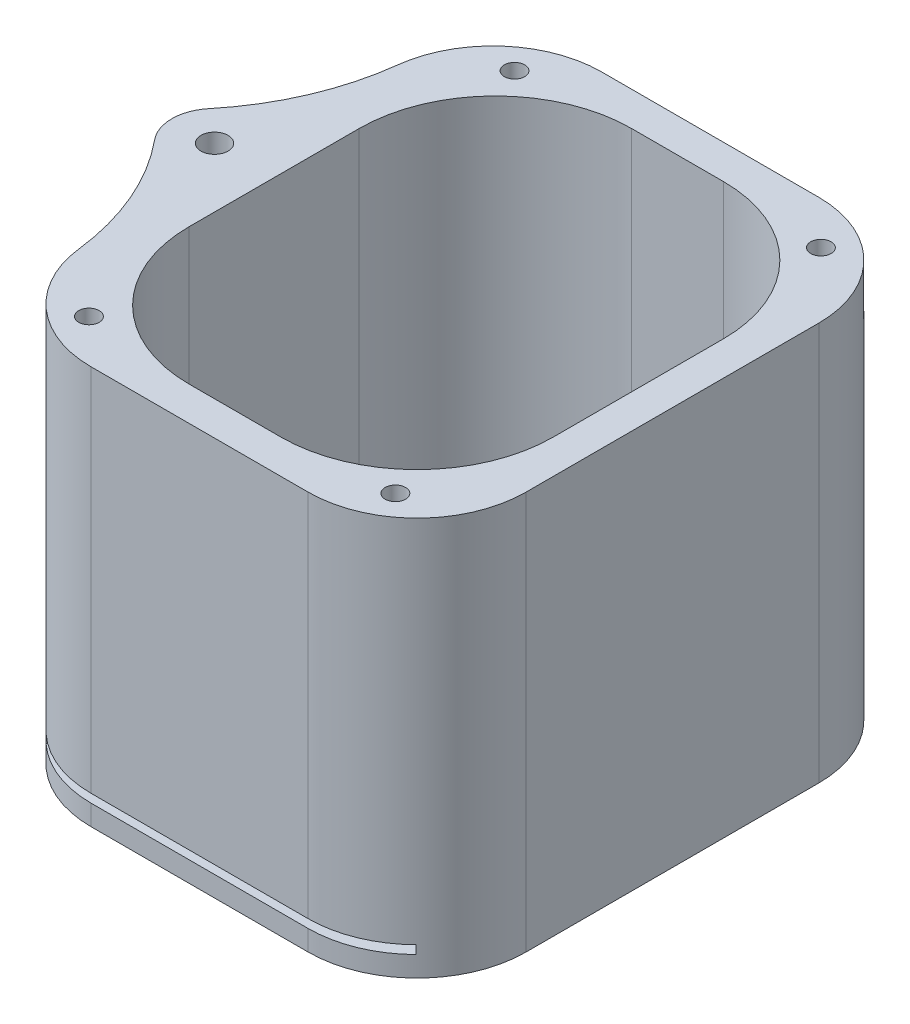
from build123d import *

# Parameters (mm, degrees)
CUT_EXTRUDE1_REACH       = 130.224
SKETCH3_W                = 13.598117377
SKETCH3_H                = 26.0138757
BOSS_EXTRUDE1_DEPTH      = 75
BOSS_EXTRUDE1_DEPTH_BACK = 75
SKETCH2_W                = 127
SKETCH2_H                = 117
BOSS_EXTRUDE3_START      = -117
BOSS_EXTRUDE3_DEPTH      = 117
CUT_EXTRUDE2_DEPTH       = 200.610245228
CUT_EXTRUDE2_DEPTH_BACK  = 200.610245228
SKETCH5_W                = 107
SKETCH5_H                = 130
CUT_EXTRUDE3_DEPTH       = 239.158035766
CUT_EXTRUDE3_DEPTH_BACK  = 239.158035766
SKETCH6_W                = 108
SKETCH6_H                = 2.5
FILLET3_R                = 40
FILLET2_R                = 32
CHAMFER1_SIZE            = 1
SKETCH7_R                = 3
CUT_EXTRUDE4_DEPTH       = 8


with BuildPart() as part:
    # Sketch1 → Revolve1 (revolve)
    with BuildSketch(Plane.XY, mode=Mode.PRIVATE) as revolve1_sk:
        Polygon((4, 0), (4, 127), (12.5, 127), (12.5, 10), (7.5, 10), (7.5, 0), align=None)
    revolve(revolve1_sk.sketch.rotate(Axis((0, 0, 0), (0, 1, 0)), 90), axis=Axis((0, 0, 0), (0, 1, 0)))

    # Sketch3 → Cut-Extrude1 (cut, up to next)
    with BuildSketch(Plane.XZ, mode=Mode.PRIVATE) as cut_extrude1_sk1:
        with Locations((14.299058689, 0)):
            Rectangle(SKETCH3_W, SKETCH3_H)
    cut_extrude1_tool1 = extrude(cut_extrude1_sk1.sketch, amount=-CUT_EXTRUDE1_REACH, mode=Mode.PRIVATE) & part.part
    add(cut_extrude1_tool1.solids().sort_by_distance((14.299059, 0, 0))[0], mode=Mode.SUBTRACT)



with BuildPart() as body_2:
    # Sketch2 → Boss-Extrude1 (new, two sides: drawn at the far end of the back side and taken through both)
    with BuildSketch(Plane.XY.offset(-BOSS_EXTRUDE1_DEPTH_BACK)):
        with Locations((71, 68.5)):
            Rectangle(SKETCH2_W, SKETCH2_H)
    extrude(amount=BOSS_EXTRUDE1_DEPTH + BOSS_EXTRUDE1_DEPTH_BACK)


with BuildPart() as part_1:
    add(part.part)

    add(body_2.part)  # Boss-Extrude3 merges body 2
    # Sketch4 → Boss-Extrude3 (add)
    with BuildSketch(Plane(origin=(0, 127, 0), x_dir=(1, 0, 0), z_dir=(0, 1, 0)).offset(BOSS_EXTRUDE3_START)):
        with BuildLine():
            Line((7.5, -55.677643628), (7.5, -10))
            ThreePointArc((7.5, -10), (-1.481398078, -12.411907981), (-9.642857143, -7.95394909))
            ThreePointArc((-9.642857143, -7.95394909), (3.084296109, -30.323015986), (7.5, -55.677643628))
        make_face()
        with BuildLine():
            Line((7.5, 10), (7.5, 55.677643628))
            ThreePointArc((7.5, 55.677643628), (3.084296109, 30.323015986), (-9.642857143, 7.95394909))
            ThreePointArc((-9.642857143, 7.95394909), (-1.481398078, 12.411907981), (7.5, 10))
        make_face()
    extrude(amount=BOSS_EXTRUDE3_DEPTH)

    # Sketch5 → Cut-Extrude2 (cut, two sides: drawn at the far end of the back side and taken through both)
    with BuildSketch(Plane(origin=(0, 127, 0), x_dir=(1, 0, 0), z_dir=(0, 1, 0)).offset(-CUT_EXTRUDE2_DEPTH_BACK)):
        with Locations((71, 0)):
            Rectangle(SKETCH5_W, SKETCH5_H)
    extrude(amount=CUT_EXTRUDE2_DEPTH + CUT_EXTRUDE2_DEPTH_BACK, mode=Mode.SUBTRACT)

    # Sketch6 → Cut-Extrude3 (cut, two sides: drawn at the far end of the back side and taken through both)
    with BuildSketch(Plane.XY.offset(75).offset(-CUT_EXTRUDE3_DEPTH_BACK)):
        with Locations((71, 17.25)):
            Rectangle(SKETCH6_W, SKETCH6_H)
    extrude(amount=CUT_EXTRUDE3_DEPTH + CUT_EXTRUDE3_DEPTH_BACK, mode=Mode.SUBTRACT)

    # Fillet3
    fillet3_edges = [part_1.edges().sort_by_distance(p)[0] for p in [
        (17.5, 13, -65),
        (124.5, 13, -65),
        (124.5, 13, 65),
        (17.5, 13, 65),
        (17.5, 72.75, -65),
        (17.5, 72.75, 65),
        (124.5, 72.75, 65),
        (124.5, 72.75, -65),
    ]]
    fillet(fillet3_edges, radius=FILLET3_R)

    # Fillet2
    # the kernel refuses this fillet: 32 mm, written as the material it takes off along each edge
    with BuildSketch(Plane(origin=(7.5, -68.115762804, -75), x_dir=(1, 0, 0), z_dir=(0, 1, 0))) as fillet2_piece_1:
        with BuildLine():
            CenterArc((31.246305122, -32), FILLET2_R, 90, 83.19545987)
            Line((-0.528290802, -28.208555177), (-3.705750395, -27.829410694))
            ThreePointArc((-3.705750395, -27.829410694), (-3.2, -19.322356372), (-3.2, 0))
            Line((-3.2, 0), (0, 3.2))
            Line((0, 3.2), (31.246305122, 3.2))
            Line((31.246305122, 3.2), (31.246305122, 0))
        make_face()
    extrude(amount=273.231525609, mode=Mode.SUBTRACT)
    with BuildSketch(Plane(origin=(134.5, 207, -75), x_dir=(0, 0, 1), z_dir=(0, -1, 0)), Plane(origin=(134.5, 207, 75), x_dir=(-1, 0, 0), z_dir=(0, -1, 0))) as fillet2_piece_2:
        with BuildLine():
            CenterArc((FILLET2_R, FILLET2_R), FILLET2_R, 180, 90)
            Line((0, FILLET2_R), (0, 0))
            Line((0, 0), (FILLET2_R, 0))
        make_face()
    extrude(amount=277, mode=Mode.SUBTRACT)
    with BuildSketch(Plane(origin=(7.5, -68.115762804, 75), x_dir=(1, 0, 0), z_dir=(0, 1, 0))) as fillet2_piece_3:
        with BuildLine():
            CenterArc((31.246305122, 32), FILLET2_R, 186.80454013, 83.19545987)
            Line((-0.528290802, 28.208555177), (-3.705750395, 27.829410694))
            ThreePointArc((-3.705750395, 27.829410694), (-3.2, 19.322356372), (-3.2, 0))
            Line((-3.2, 0), (0, -3.2))
            Line((0, -3.2), (31.246305122, -3.2))
            Line((31.246305122, -3.2), (31.246305122, 0))
        make_face()
    extrude(amount=273.231525609, mode=Mode.SUBTRACT)

    # Chamfer1
    chamfer1_edges = [part_1.edges().sort_by_distance(p)[0] for p in [
        (0, 0, 7.5),
    ]]
    chamfer(chamfer1_edges, length=CHAMFER1_SIZE)

    # Sketch7 → Cut-Extrude4 (cut)
    with BuildSketch(Plane(origin=(0, 127, 0), x_dir=(1, 0, 0), z_dir=(0, 1, 0))):
        with Locations(Location((115.623152561, -62.5, 0), (0, 0, 270))):
            Circle(SKETCH7_R)
        with Locations(Location((25.623152561, -62.5, 0), (0, 0, 270))):
            Circle(SKETCH7_R)
        with Locations(Location((25.623152561, 62.5, 0), (0, 0, 270))):
            Circle(SKETCH7_R)
        with Locations(Location((115.623152561, 62.5, 0), (0, 0, 270))):
            Circle(SKETCH7_R)
    extrude(amount=-CUT_EXTRUDE4_DEPTH, mode=Mode.SUBTRACT)


solid = part_1.part
